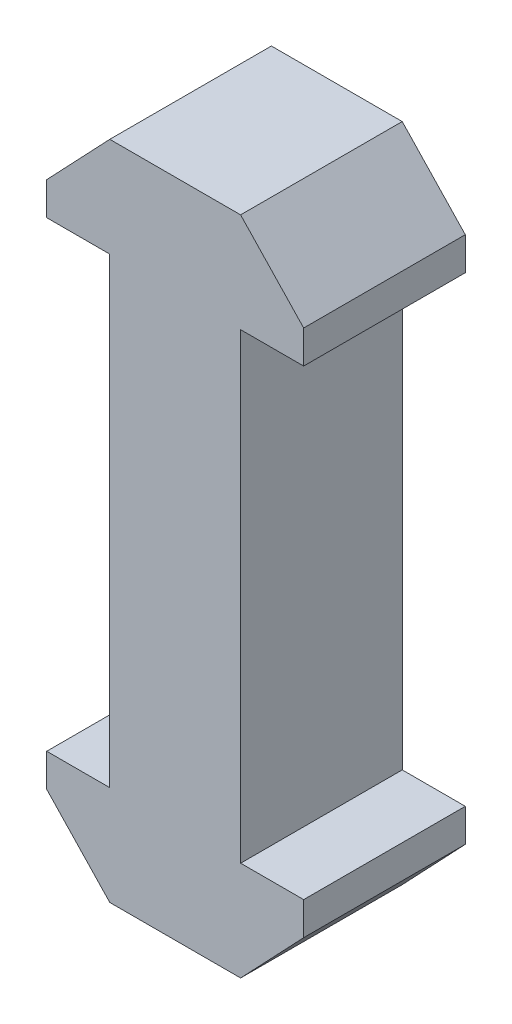
from build123d import *

# Parameters (mm, degrees)
BOSS_EXTRUDE1_DEPTH = 5


with BuildPart() as part:
    # Sketch1 → Boss-Extrude1 (new, symmetric)
    with BuildSketch(Plane.XY):
        Polygon((7.95, 0), (4.05, 0), (4.05, 28.590630691), (7.95, 28.590630691), (7.95, 30.630630691), (4.048, 34.743045674), (-4.048, 34.743045674), (-7.95, 30.630630691), (-7.95, 28.590630691), (-4.05, 28.590630691), (-4.05, 0), (-7.95, 0), (-7.95, -2.04), (-4.048, -6.152414984), (4.048, -6.152414984), (7.95, -2.04), align=None)
    extrude(amount=BOSS_EXTRUDE1_DEPTH, both=True)


solid = part.part
